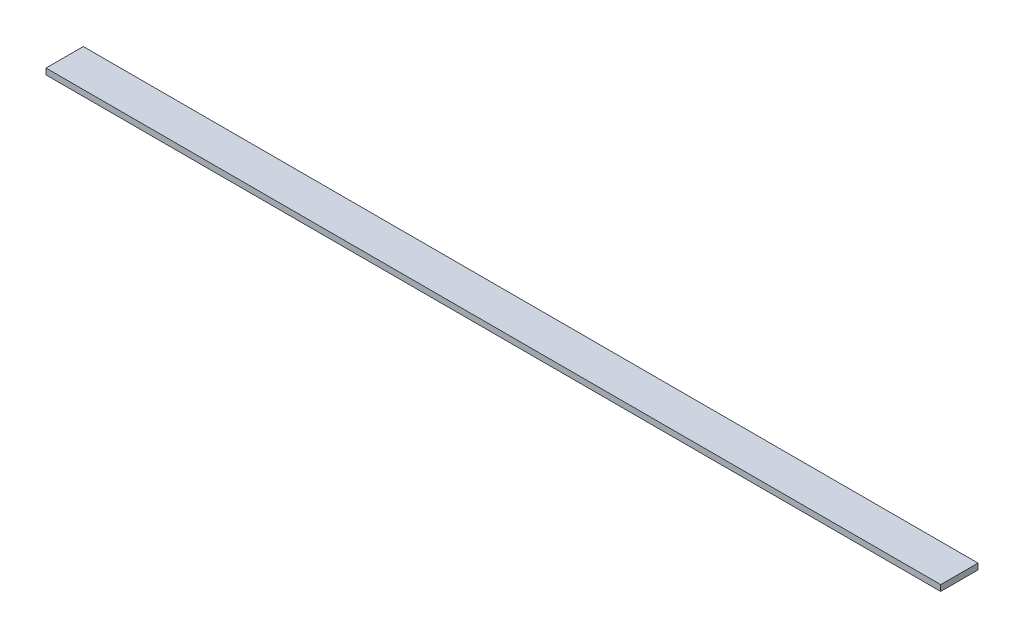
from build123d import *

# Parameters (mm, degrees)
SKETCH_1_W      = 1200
SKETCH_1_H      = 50
EXTRUDE_1_DEPTH = 8


with BuildPart() as part:
    # Эскиз1 → Бобышка-Вытянуть1 (new body)
    with BuildSketch(Plane(origin=(0, 0, 0), x_dir=(1, 0, 0), z_dir=(0, 1, 0))):
        Rectangle(SKETCH_1_W, SKETCH_1_H)
    extrude(amount=EXTRUDE_1_DEPTH)


solid = part.part
